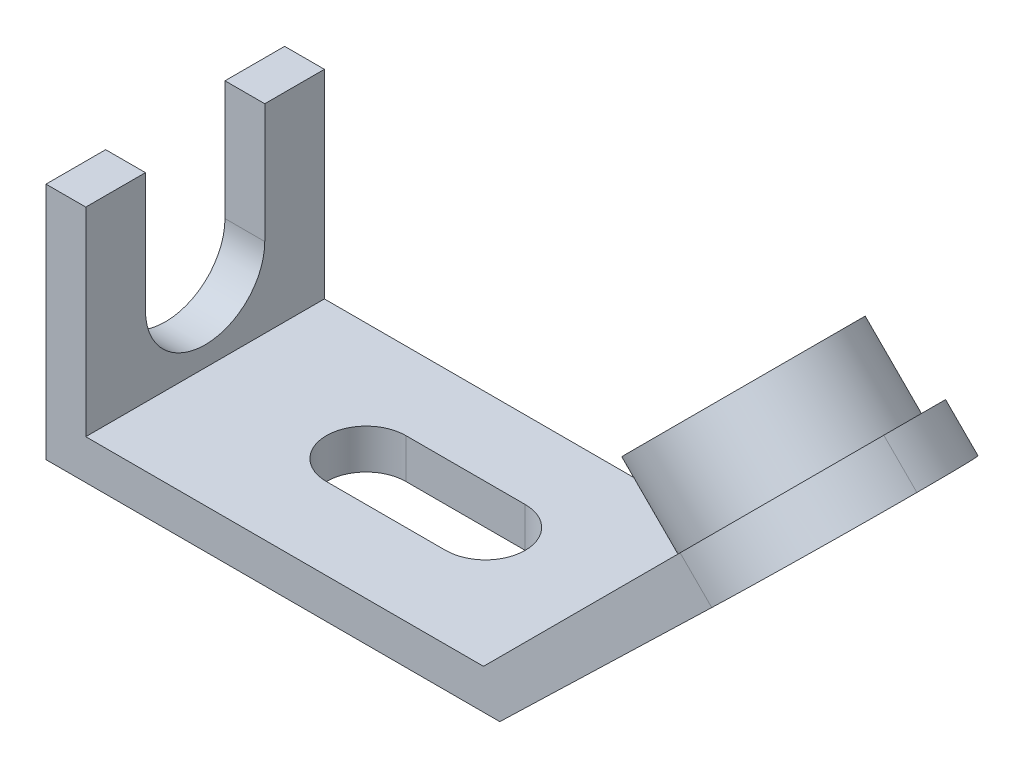
from build123d import *

# Parameters (mm, degrees)
BOSS_EXTRUDE1_DEPTH = 60
SKETCH2_R           = 25
SKETCH2_R_2         = 15
BOSS_EXTRUDE2_DEPTH = 20
FILLET1_R           = 30
CUT_EXTRUDE1_DEPTH  = 20
CUT_EXTRUDE2_DEPTH  = 20
CUT_EXTRUDE3_START  = -14
SKETCH6_R           = 15
CUT_EXTRUDE3_DEPTH  = 14


with BuildPart() as part:
    # Sketch1 → Boss-Extrude1 (new body)
    with BuildSketch(Plane.XY):
        Polygon((0, 0), (0, 60), (10, 60), (10, 10), (110, 10), (180.64896405, 80.64896405), (188.962882852, 72.335045249), (114.1, 0), align=None)
    extrude(amount=BOSS_EXTRUDE1_DEPTH)

    # Sketch2 → Boss-Extrude2 (add)
    with BuildSketch(Plane(origin=(50, -50, 0), x_dir=(0, 0, 1), z_dir=(-0.7071067811865477, 0.7071067811865474, 0))):
        with Locations(Location((30, 154.852813742, 0), (0, 0, 90))):
            Circle(SKETCH2_R)
        with Locations(Location((30, 154.852813742, 0), (0, 0, 270))):
            Circle(SKETCH2_R_2, mode=Mode.SUBTRACT)
    extrude(amount=BOSS_EXTRUDE2_DEPTH)

    # Fillet1
    fillet1_edges = [part.edges().sort_by_distance(p)[0] for p in [
        (184.805923451, 76.49200465, 60),
        (184.805923451, 76.49200465, 0),
    ]]
    fillet(fillet1_edges, radius=FILLET1_R - 0.0001)  # a hair under: the kernel refuses the full size

    # Sketch3 → Cut-Extrude1 (cut)
    with BuildSketch(Plane(origin=(0, 10, 0), x_dir=(1, 0, 0), z_dir=(0, 1, 0))):
        with BuildLine():
            Line((50, -19.514580566), (80, -19.514580566))
            ThreePointArc((80, -19.514580566), (90, -29.514580566), (80, -39.514580566))
            Line((80, -39.514580566), (50, -39.514580566))
            ThreePointArc((50, -39.514580566), (40, -29.514580566), (50, -19.514580566))
        make_face()
    extrude(amount=-CUT_EXTRUDE1_DEPTH, mode=Mode.SUBTRACT)

    # Sketch5 → Cut-Extrude2 (cut)
    with BuildSketch(Plane.ZY):
        with BuildLine():
            Line((15, 30), (15, 130))
            ThreePointArc((15, 130), (30, 145), (45, 130))
            Line((45, 130), (45, 30))
            ThreePointArc((45, 30), (30, 15), (15, 30))
        make_face()
    extrude(amount=-CUT_EXTRUDE2_DEPTH, mode=Mode.SUBTRACT)

    # Sketch6 → Cut-Extrude3 (cut)
    with BuildSketch(Plane(origin=(50, -50, 0), x_dir=(0, 0, 1), z_dir=(-0.7071067811865477, 0.7071067811865474, 0)).offset(CUT_EXTRUDE3_START)):
        with Locations(Location((30, 154.852813742, 0), (0, 0, 270))):
            Circle(SKETCH6_R)
    extrude(amount=CUT_EXTRUDE3_DEPTH, mode=Mode.SUBTRACT)


solid = part.part
